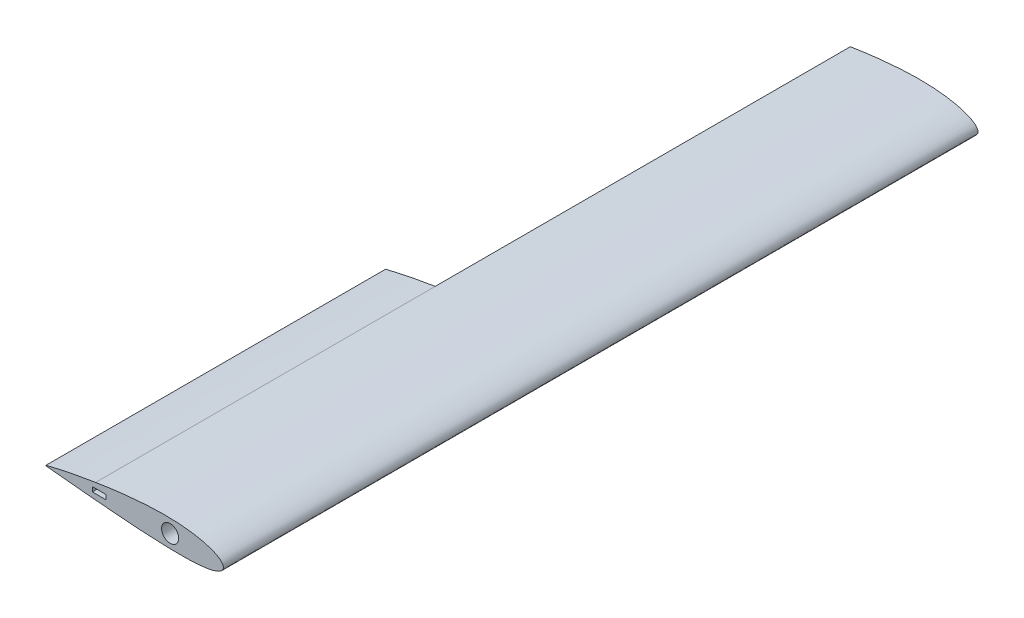
from build123d import *

# Parameters (mm, degrees)
BOSS_EXTRUDE1_DEPTH = 1120
BOSS_EXTRUDE2_DEPTH = 504
SKETCH3_R           = 12.7
CUT_EXTRUDE1_DEPTH  = 801
SKETCH4_W           = 32
SKETCH4_H           = 36.447
CUT_EXTRUDE2_DEPTH  = 46
SKETCH5_W           = 60
SKETCH5_H           = 12
CUT_EXTRUDE3_DEPTH  = 46
SKETCH6_W           = 54
SKETCH6_H           = 29.1
CUT_EXTRUDE4_DEPTH  = 64
SKETCH7_W           = 20.4
SKETCH7_H           = 6.8
CUT_EXTRUDE5_DEPTH  = 26
SKETCH8_W           = 20
SKETCH8_H           = 4
CUT_EXTRUDE6_DEPTH  = 20


with BuildPart() as part:
    # Sketch1 → Boss-Extrude1 (new body)
    with BuildSketch(Plane.XY):
        with BuildLine():
            Line((-189.51768, 15.22180318), (-189.51768, -7.594057912))
            add(Edge.make_bspline(
                [(-189.51768, 15.22180318), (-187.136876596, 15.601366162), (-181.524230951, 16.49617021), (-172.579464945, 17.802232538), (-162.624331295, 19.156679768), (-152.468089784, 20.413314271), (-142.174389859, 21.555440709), (-131.807216331, 22.561333647), (-121.431592131, 23.412087545), (-111.09809022, 24.088783932), (-100.852699541, 24.580144077), (-90.758628261, 24.809329385), (-80.898232638, 24.77399363), (-71.356505026, 24.468713201), (-62.197588747, 23.895961111), (-53.482919919, 23.062677904), (-45.270635393, 21.981029068), (-37.614922187, 20.667926045), (-30.565430019, 19.144559752), (-24.166721597, 17.435627932), (-18.457754004, 15.56832543), (-13.471328468, 13.571084553), (-9.2334682, 11.471837779), (-5.762573754, 9.295685324), (-3.069361923, 7.05983911), (-1.160451743, 4.76712359), (-0.062486616, 2.395900773), (0.143193872, -0.014381973), (-0.535005867, -2.334312627), (-2.066575481, -4.442018603), (-4.35808441, -6.323717529), (-7.382073847, -8.014628692), (-11.126152847, -9.525505335), (-15.572910836, -10.856764315), (-20.698068341, -12.004946902), (-26.471726171, -12.966947695), (-32.859677692, -13.741486128), (-39.824281634, -14.330010396), (-47.325039447, -14.737142351), (-55.318969534, -14.970891481), (-63.760848547, -15.042618039), (-72.603366817, -14.966844651), (-81.797212753, -14.760620179), (-91.291189184, -14.443700222), (-101.051153964, -14.033946936), (-111.03675854, -13.558968959), (-121.186604583, -12.976167513), (-131.420976293, -12.309963824), (-141.663461573, -11.57777303), (-151.852085641, -10.797045285), (-161.92483625, -9.983627929), (-171.819962515, -9.151038953), (-180.998123604, -8.355867052), (-186.870326573, -7.830781275), (-189.51768, -7.594057912)],
                knots=[0, 0, 0, 0, 0.018424224, 0.043434346, 0.069080412, 0.095203092, 0.121640117, 0.148227444, 0.17480049, 0.201195447, 0.227363977, 0.253181792, 0.278347264, 0.302710399, 0.326128333, 0.348466602, 0.369600377, 0.389415723, 0.407811011, 0.424698681, 0.44000774, 0.453687637, 0.465714725, 0.476103672, 0.484928355, 0.492360154, 0.498730164, 0.504586951, 0.510443348, 0.516803825, 0.524198712, 0.532940661, 0.543185695, 0.554995644, 0.568376342, 0.583298542, 0.599709376, 0.617538825, 0.636703502, 0.65710892, 0.678650912, 0.701216586, 0.724685048, 0.748928058, 0.7738107, 0.799337901, 0.825325561, 0.851504471, 0.877716004, 0.903800001, 0.929595993, 0.954944401, 0.979687675, 1, 1, 1, 1], degree=3))
        make_face()
    extrude(amount=-BOSS_EXTRUDE1_DEPTH)

    # Sketch2 → Boss-Extrude2 (add)
    with BuildSketch(Plane.XY):
        with BuildLine():
            Line((-189.51768, 15.22180318), (-189.51768, -7.594057912))
            add(Edge.make_bspline(
                [(-189.51768, -7.594057912), (-189.996202452, -7.551527163), (-193.482135901, -7.241699773), (-199.836465271, -6.660057854), (-208.425197461, -5.865414463), (-216.546681577, -5.099536763), (-224.14967482, -4.371263144), (-231.185731921, -3.686585618), (-237.609816347, -3.051794217), (-243.380580351, -2.473169974), (-248.460634027, -1.956044351), (-252.817020389, -1.508119539), (-256.420946666, -1.129170427), (-259.24954449, -0.839207544), (-261.282177522, -0.605141161), (-262.509467907, -0.506345529), (-263.063019725, -0.413096521), (-263.209805993, -0.413618993), (-263.219, -0.413651718)],
                knots=[0, 0, 0, 0, 0.019462551, 0.14178051, 0.258505433, 0.368899529, 0.472261554, 0.567931303, 0.655293986, 0.733784513, 0.802891701, 0.862162346, 0.911205133, 0.949694244, 0.977372582, 0.994054454, 0.999627599, 1, 1, 1, 1], degree=3))
            Line((-263.219, -0.413651718), (-263.219, 0.420386619))
            add(Edge.make_bspline(
                [(-189.51768, 15.22180318), (-190.266788664, 15.104463964), (-194.02509574, 14.515768592), (-200.638331307, 13.39129513), (-209.199500811, 11.881315245), (-217.274730538, 10.377747142), (-224.816900921, 8.910685073), (-231.780702955, 7.499620602), (-238.124944209, 6.166301654), (-243.81225182, 4.931297205), (-248.809365376, 3.814413248), (-253.087249335, 2.834113225), (-256.621202113, 2.007090366), (-259.39094467, 1.347844077), (-261.380642681, 0.868109535), (-262.569816785, 0.578993853), (-263.094507616, 0.450802366), (-263.219, 0.420386619)],
                knots=[0, 0, 0, 0, 0.030251696, 0.151773928, 0.267626296, 0.377089872, 0.479484952, 0.574174897, 0.660569789, 0.738129949, 0.806369318, 0.864858701, 0.913228834, 0.951173208, 0.978450569, 0.994887008, 1, 1, 1, 1], degree=3))
        make_face()
    extrude(amount=-BOSS_EXTRUDE2_DEPTH)

    # Sketch3 → Cut-Extrude1 (cut)
    with BuildSketch(Plane.XY):
        with Locations((-78.966, 4.935)):
            Circle(SKETCH3_R)
    extrude(amount=-CUT_EXTRUDE1_DEPTH, mode=Mode.SUBTRACT)

    # Sketch4 → Cut-Extrude2 (cut)
    with BuildSketch(Plane.XY.offset(-376.7)):
        with Locations((-78.966, 2.4115)):
            Rectangle(SKETCH4_W, SKETCH4_H)
    extrude(amount=CUT_EXTRUDE2_DEPTH, mode=Mode.SUBTRACT)

    # Sketch5 → Cut-Extrude3 (cut)
    with BuildSketch(Plane.XY.offset(-376.7)):
        with Locations((-210.5752, -1.706)):
            Rectangle(SKETCH5_W, SKETCH5_H)
    extrude(amount=CUT_EXTRUDE3_DEPTH, mode=Mode.SUBTRACT)

    # Sketch6 → Cut-Extrude4 (cut)
    with BuildSketch(Plane.XY.offset(-598.5)):
        with Locations((-144.771, 0.191)):
            Rectangle(SKETCH6_W, SKETCH6_H)
    extrude(amount=CUT_EXTRUDE4_DEPTH, mode=Mode.SUBTRACT)

    # Sketch7 → Cut-Extrude5 (cut)
    with BuildSketch(Plane.XY.offset(-25.5)):
        with Locations((-184.254, 3.948)):
            Rectangle(SKETCH7_W, SKETCH7_H)
    extrude(amount=CUT_EXTRUDE5_DEPTH, mode=Mode.SUBTRACT)

    # Sketch8 → Cut-Extrude6 (cut)
    with BuildSketch(Plane.XY.offset(-930)):
        with Locations((-50, -13.979)):
            Rectangle(SKETCH8_W, SKETCH8_H)
    extrude(amount=CUT_EXTRUDE6_DEPTH, mode=Mode.SUBTRACT)


solid = part.part
